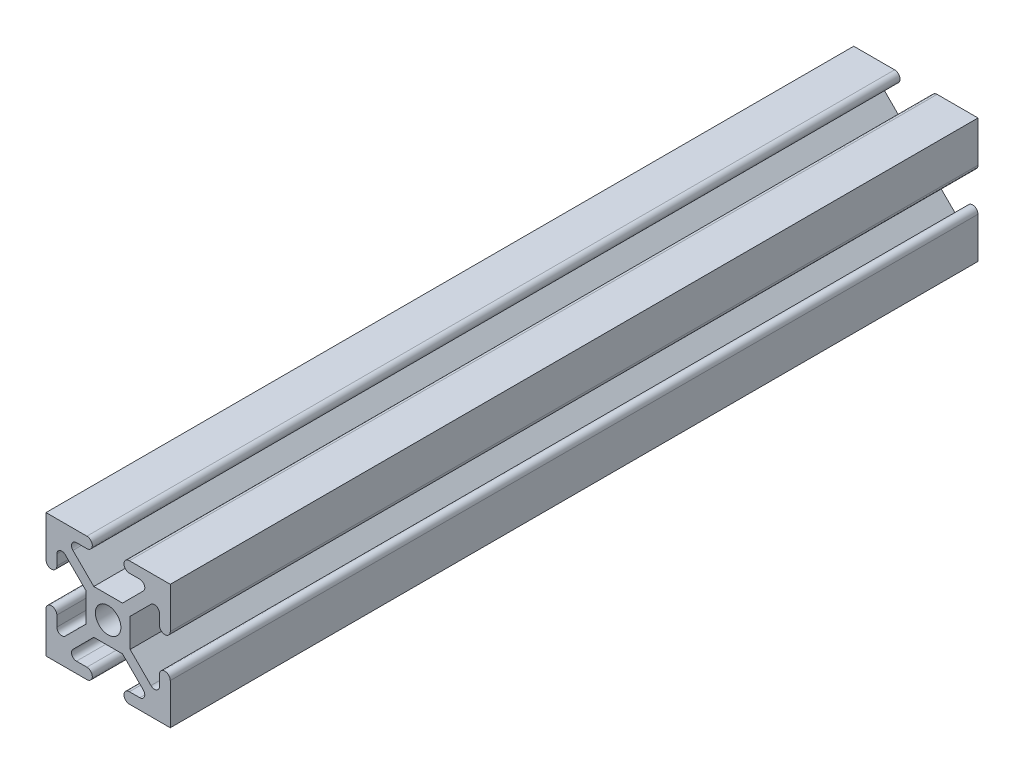
from build123d import *

# Parameters (mm, degrees)
SKETCH1_R           = 2.6035
BOSS_EXTRUDE1_DEPTH = 165.1


with BuildPart() as part:
    # Sketch1 → Boss-Extrude1 (new body)
    with BuildSketch(Plane.XY):
        with BuildLine():
            Line((-12.7, -12.7), (-4.343399971, -12.7))
            ThreePointArc((-4.343399971, -12.7), (-3.238499971, -11.5951), (-4.343399971, -10.4902))
            Line((-4.343399971, -10.4902), (-6.474794456, -10.4902))
            ThreePointArc((-6.474794456, -10.4902), (-7.413456061, -9.863006367), (-7.193214945, -8.75577951))
            Line((-7.193214945, -8.75577951), (-2.933235435, -4.4958))
            Line((-2.933235435, -4.4958), (2.933235435, -4.4958))
            Line((2.933235435, -4.4958), (7.193214945, -8.75577951))
            ThreePointArc((7.193214945, -8.75577951), (7.413456061, -9.863006367), (6.474794456, -10.4902))
            Line((6.474794456, -10.4902), (4.3434, -10.4902))
            ThreePointArc((4.3434, -10.4902), (3.2385, -11.5951), (4.3434, -12.7))
            Line((4.3434, -12.7), (12.7, -12.7))
            Line((12.7, -12.7), (12.7, -4.343399971))
            ThreePointArc((12.7, -4.343399971), (11.5951, -3.238499971), (10.4902, -4.343399971))
            Line((10.4902, -4.343399971), (10.4902, -6.474794456))
            ThreePointArc((10.4902, -6.474794456), (9.863006367, -7.413456061), (8.75577951, -7.193214945))
            Line((8.75577951, -7.193214945), (4.4958, -2.933235435))
            Line((4.4958, -2.933235435), (4.4958, 2.933235435))
            Line((4.4958, 2.933235435), (8.75577951, 7.193214945))
            ThreePointArc((8.75577951, 7.193214945), (9.863006367, 7.413456061), (10.4902, 6.474794456))
            Line((10.4902, 6.474794456), (10.4902, 4.3434))
            ThreePointArc((10.4902, 4.3434), (11.5951, 3.2385), (12.7, 4.3434))
            Line((12.7, 4.3434), (12.7, 12.7))
            Line((12.7, 12.7), (4.343399971, 12.7))
            ThreePointArc((4.343399971, 12.7), (3.238499971, 11.5951), (4.343399971, 10.4902))
            Line((4.343399971, 10.4902), (6.474794456, 10.4902))
            ThreePointArc((6.474794456, 10.4902), (7.413456061, 9.863006367), (7.193214945, 8.75577951))
            Line((7.193214945, 8.75577951), (2.933235435, 4.4958))
            Line((2.933235435, 4.4958), (-2.933235435, 4.4958))
            Line((-2.933235435, 4.4958), (-7.193214945, 8.75577951))
            ThreePointArc((-7.193214945, 8.75577951), (-7.413456061, 9.863006367), (-6.474794456, 10.4902))
            Line((-6.474794456, 10.4902), (-4.3434, 10.4902))
            ThreePointArc((-4.3434, 10.4902), (-3.2385, 11.5951), (-4.3434, 12.7))
            Line((-4.3434, 12.7), (-12.7, 12.7))
            Line((-12.7, 12.7), (-12.7, 4.343399971))
            ThreePointArc((-12.7, 4.343399971), (-11.5951, 3.238499971), (-10.4902, 4.343399971))
            Line((-10.4902, 4.343399971), (-10.4902, 6.474794456))
            ThreePointArc((-10.4902, 6.474794456), (-9.863006367, 7.413456061), (-8.75577951, 7.193214945))
            Line((-8.75577951, 7.193214945), (-4.4958, 2.933235435))
            Line((-4.4958, 2.933235435), (-4.4958, -2.933235435))
            Line((-4.4958, -2.933235435), (-8.75577951, -7.193214945))
            ThreePointArc((-8.75577951, -7.193214945), (-9.863006367, -7.413456061), (-10.4902, -6.474794456))
            Line((-10.4902, -6.474794456), (-10.4902, -4.3434))
            ThreePointArc((-10.4902, -4.3434), (-11.5951, -3.2385), (-12.7, -4.3434))
            Line((-12.7, -4.3434), (-12.7, -12.7))
        make_face()
        Circle(SKETCH1_R, mode=Mode.SUBTRACT)
    extrude(amount=-BOSS_EXTRUDE1_DEPTH)


solid = part.part
